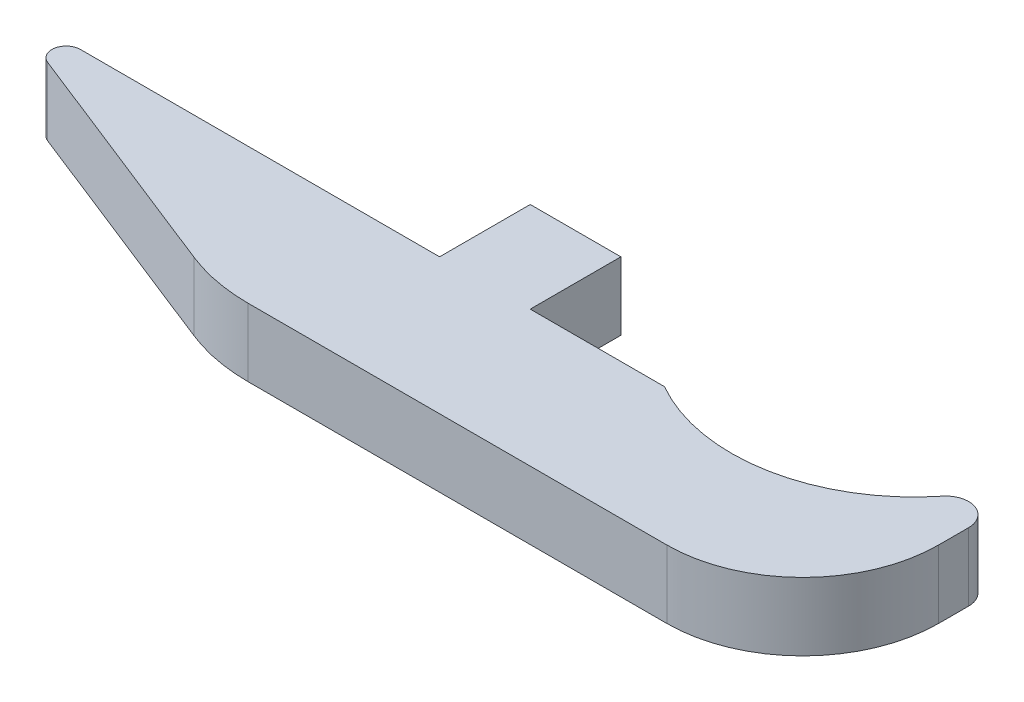
from build123d import *

# Parameters (mm, degrees)
BOSS_EXTRUDE1_DEPTH = 4.7625
FILLET1_R           = 9.525
FILLET2_R           = 1.5875
FILLET4_R           = 12.7
BOSS_EXTRUDE2_DEPTH = 4.7625
FILLET5_R           = 1


with BuildPart() as part:
    # Sketch1 → Boss-Extrude1 (new body)
    with BuildSketch(Plane(origin=(0, 0, 0), x_dir=(1, 0, 0), z_dir=(0, 1, 0))):
        with BuildLine():
            ThreePointArc((68.55459999999994, 11.1252), (62.15558311010997, 0.02506657124609291), (49.34309892630538, 3.1797e-13))
            Line((49.3430989263053, 3.98e-15), (3.17499999999972, 1.88e-15))
            Line((3.174999999999723, -3.02e-15), (27.279599999999938, -9.525))
            Line((27.279599999999938, -9.525), (68.55459999999994, -9.525))
            Line((68.55459999999994, -9.525), (68.55459999999994, 11.125200000000005))
        make_face()
    extrude(amount=BOSS_EXTRUDE1_DEPTH)

    # Fillet1
    fillet1_edges = [part.edges().sort_by_distance(p)[0] for p in [
        (68.55459999999994, 2.38125, 9.525),
    ]]
    fillet(fillet1_edges, radius=FILLET1_R)

    # Fillet2
    fillet2_edges = [part.edges().sort_by_distance(p)[0] for p in [
        (68.55459999999994, 2.38125, -11.125200000000003),
    ]]
    fillet(fillet2_edges, radius=FILLET2_R)

    # Fillet4
    fillet4_edges = [part.edges().sort_by_distance(p)[0] for p in [
        (27.279599999999938, 2.38125, 9.525),
    ]]
    fillet(fillet4_edges, radius=FILLET4_R)

    # Sketch2 → Boss-Extrude2 (add)
    with BuildSketch(Plane.XZ):
        Polygon((33.58949999999994, -6.349999999999999), (39.93949999999993, -6.349999999999998), (39.93949999999993, 5.33e-15), (33.58949999999994, 4.43e-15), align=None)
    extrude(amount=-BOSS_EXTRUDE2_DEPTH)

    # Fillet5
    fillet5_edges = [part.edges().sort_by_distance(p)[0] for p in [
        (3.174999999999722, 2.38125, 5.7e-16),
    ]]
    fillet(fillet5_edges, radius=FILLET5_R)


solid = part.part
